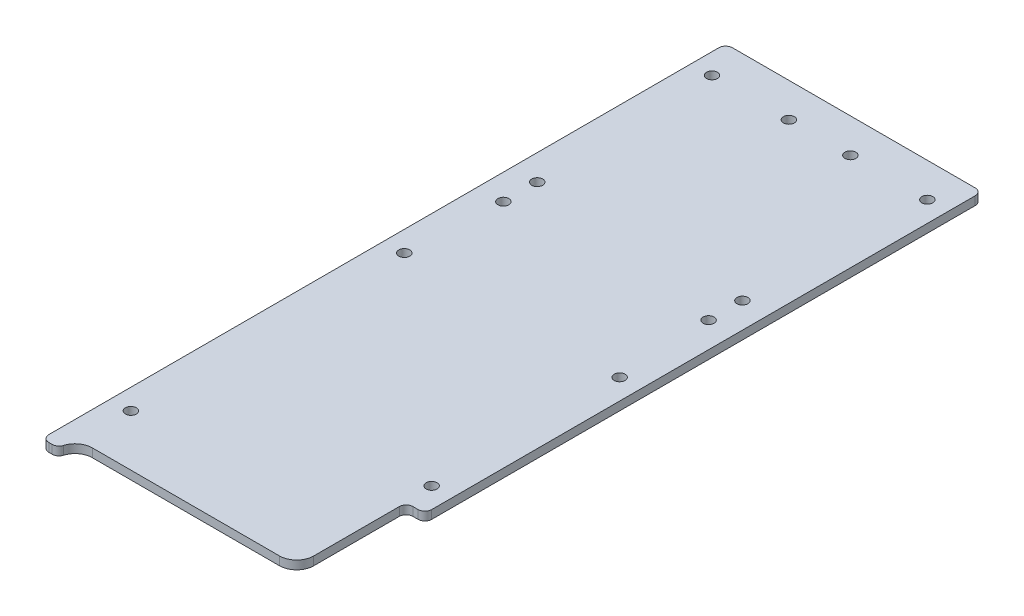
from build123d import *

# Parameters (mm, degrees)
SKETCH1_R           = 2.032
BOSS_EXTRUDE1_DEPTH = 3.175
FILLET1_R           = 2.54
FILLET2_R           = 2.54
FILLET3_R           = 6.35
CUT_EXTRUDE1_DEPTH  = 136.673215063
FILLET4_R           = 6.35
FILLET5_R           = 2.54
SKETCH3_R           = 2.032
CUT_EXTRUDE2_DEPTH  = 136.673215063


with BuildPart() as part:
    # Sketch1 → Boss-Extrude1 (new body)
    with BuildSketch(Plane(origin=(0, 0, 0), x_dir=(1, 0, 0), z_dir=(0, 1, 0))):
        Polygon((47.625, 127), (-47.625, 127), (-47.625, -127), (-41.275, -127), (-41.275, -120.65), (41.275, -120.65), (41.275, -127), (47.625, -127), align=None)
        with Locations((-39.999684148, -101.6)):
            Circle(SKETCH1_R, mode=Mode.SUBTRACT)
        with Locations((39.999684148, -69.85)):
            Circle(SKETCH1_R, mode=Mode.SUBTRACT)
        with Locations((-39.999684148, 0)):
            Circle(SKETCH1_R, mode=Mode.SUBTRACT)
        with Locations((-39.999684148, 114.3)):
            Circle(SKETCH1_R, mode=Mode.SUBTRACT)
        with Locations((-11.424684148, 114.3)):
            Circle(SKETCH1_R, mode=Mode.SUBTRACT)
        with Locations((39.999684148, 0)):
            Circle(SKETCH1_R, mode=Mode.SUBTRACT)
        with Locations((11.424684148, 114.3)):
            Circle(SKETCH1_R, mode=Mode.SUBTRACT)
        with Locations((39.999684148, 114.3)):
            Circle(SKETCH1_R, mode=Mode.SUBTRACT)
    extrude(amount=BOSS_EXTRUDE1_DEPTH)

    # Fillet1
    fillet1_edges = [part.edges().sort_by_distance(p)[0] for p in [
        (-47.625, 1.5875, -127),
        (47.625, 1.5875, -127),
        (47.625, 1.5875, 127),
        (-47.625, 1.5875, 127),
    ]]
    fillet(fillet1_edges, radius=FILLET1_R)

    # Fillet2
    fillet2_edges = [part.edges().sort_by_distance(p)[0] for p in [
        (41.275, 1.5875, 127),
        (-41.275, 1.5875, 127),
    ]]
    fillet(fillet2_edges, radius=FILLET2_R)

    # Fillet3
    fillet3_edges = [part.edges().sort_by_distance(p)[0] for p in [
        (41.275, 1.5875, 120.65),
        (-41.275, 1.5875, 120.65),
    ]]
    fillet(fillet3_edges, radius=FILLET3_R)

    # Sketch2 → Cut-Extrude1 (cut, through all)
    with BuildSketch(Plane.XZ):
        with BuildLine():
            Line((47.625, 131.883089137), (41.91, 131.883089137))
            Line((41.91, 131.883089137), (41.91, 126.140052083))
            ThreePointArc((41.91, 126.140052083), (41.593586007, 125.69163301), (41.380880287, 125.185714286))
            ThreePointArc((41.380880287, 125.185714286), (41.067204187, 124.352196031), (40.64, 123.570760199))
            Line((40.64, 123.570760199), (40.64, 79.981419179))
            Line((40.64, 79.981419179), (47.625, 79.981419179))
            Line((47.625, 79.981419179), (47.625, 131.883089137))
        make_face()
    extrude(amount=-CUT_EXTRUDE1_DEPTH, mode=Mode.SUBTRACT)

    # Fillet4
    fillet4_edges = [part.edges().sort_by_distance(p)[0] for p in [
        (40.64, 1.5875, 123.570760199),
    ]]
    fillet(fillet4_edges, radius=FILLET4_R)

    # Fillet5
    fillet5_edges = [part.edges().sort_by_distance(p)[0] for p in [
        (47.625, 1.5875, 79.981419179),
        (40.64, 1.5875, 79.981419179),
    ]]
    fillet(fillet5_edges, radius=FILLET5_R)

    # Sketch3 → Cut-Extrude2 (cut, through all)
    with BuildSketch(Plane.XZ):
        with Locations((-38.113923425, -34.913768806)):
            Circle(SKETCH3_R)
        with Locations((-38.113923425, -47.490173279)):
            Circle(SKETCH3_R)
        with Locations((38.113923425, -47.490173279)):
            Circle(SKETCH3_R)
        with Locations((38.113923425, -34.913768806)):
            Circle(SKETCH3_R)
    extrude(amount=-CUT_EXTRUDE2_DEPTH, mode=Mode.SUBTRACT)


solid = part.part
